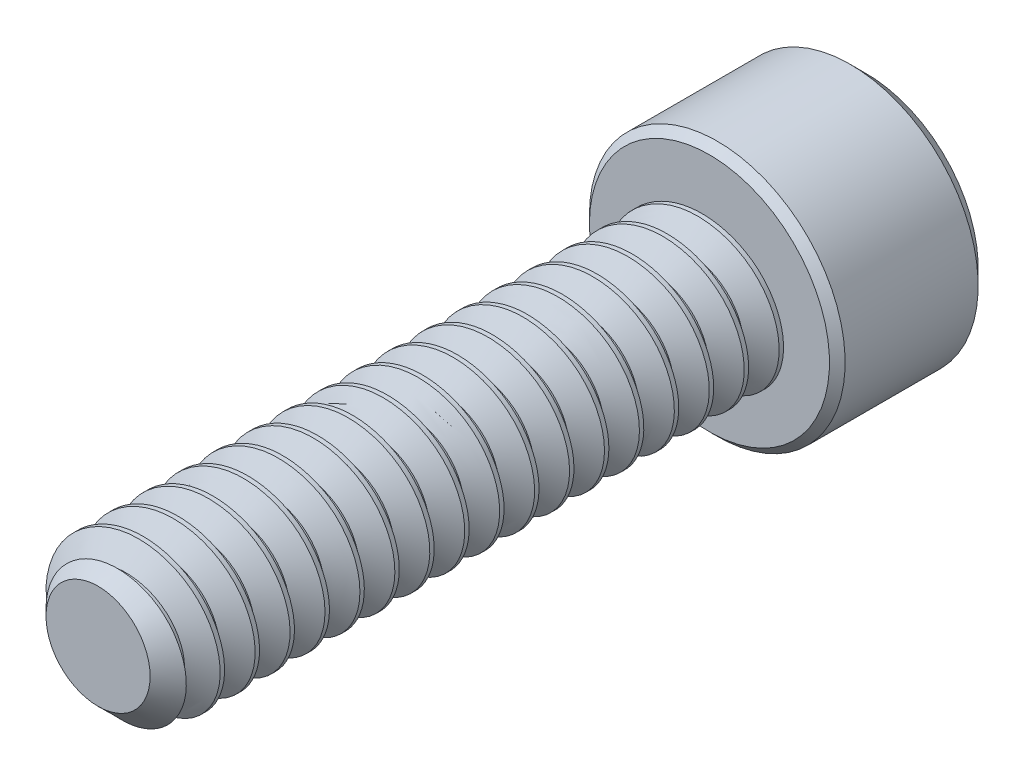
from build123d import *

# Parameters (mm, degrees)
SKETCH1_R          = 1.4224
EXTRUDE1_DEPTH     = 11.1125
CHAMFER3_SIZE      = 0.47625
CUT_SWEEP1_PITCH   = 0.635
SKETCH6_R          = 2.3241
EXTRUDE2_DEPTH     = 2.8448
CUT_EXTRUDE1_DEPTH = 1.7859375
SKETCH8_R          = 1.374815329
CUT_EXTRUDE2_DEPTH = 0.28448
CUT_EXTRUDE2_DRAFT = -45
CHAMFER1_SIZE      = 0.28448
CHAMFER2_SIZE      = 0.14224


with BuildPart() as part:
    # Sketch1 → Extrude1 (new body)
    with BuildSketch(Plane.XY):
        Circle(SKETCH1_R)
    extrude(amount=-EXTRUDE1_DEPTH)

    # Chamfer3
    chamfer3_edges = [part.edges().sort_by_distance(p)[0] for p in [
        (-1.4224, 0, 0),
    ]]
    chamfer(chamfer3_edges, length=CHAMFER3_SIZE)

    # Cut-Sweep1: the profile of Sketch3 profile screwed along a right-hand helix of 18.5 turns, 6 arcs to a turn; built about Z, then put on its axis
    cut_sweep1_z = Axis((0, 0, 0), (0, 0, 1))
    cut_sweep1_corners = [(1.4227, 0, -0.555798205), (1.009955401, 0, -0.3175), (1.009955401, 0, -0.238125), (1.4227, 0, 0.000173205)]
    with BuildLine(mode=Mode.PRIVATE) as cut_sweep1_profile:
        Line(cut_sweep1_corners[0], cut_sweep1_corners[1])
        Line(cut_sweep1_corners[1], cut_sweep1_corners[2])
        Line(cut_sweep1_corners[2], cut_sweep1_corners[3])
        Line(cut_sweep1_corners[3], cut_sweep1_corners[0])
    cut_sweep1_cap = Face(cut_sweep1_profile.wire())
    cut_sweep1_turn_angles = [0, 30, 60, 90, 120, 150, 180, 210, 240, 270, 300, 330, 360]
    cut_sweep1_turn_weights = [1, 0.8660254037844387, 1, 0.8660254037844387, 1, 0.8660254037844387, 1, 0.8660254037844387, 1, 0.8660254037844387, 1, 0.8660254037844387, 1]
    cut_sweep1_turn_rails = [Edge.make_bspline([Vector(p[0], p[1], 0).rotate(cut_sweep1_z, cut_sweep1_turn_angles[k]) / cut_sweep1_turn_weights[k] + Vector(0, 0, p[2] + CUT_SWEEP1_PITCH * cut_sweep1_turn_angles[k] / 360) for k in range(13)], [0, 0, 0, 1, 1, 2, 2, 3, 3, 4, 4, 5, 5, 6, 6, 6], 2, cut_sweep1_turn_weights) for p in cut_sweep1_corners]
    cut_sweep1_turn_sides = [Face.make_surface_from_curves(cut_sweep1_turn_rails[p[0]], cut_sweep1_turn_rails[p[1]]) for p in [(0, 1), (1, 2), (2, 3), (3, 0)]]
    cut_sweep1_last_angles = [6480, 6510, 6540, 6570, 6600, 6630, 6660]
    cut_sweep1_last_weights = [1, 0.8660254037844387, 1, 0.8660254037844387, 1, 0.8660254037843553, 1]
    cut_sweep1_last_rails = [Edge.make_bspline([Vector(p[0], p[1], 0).rotate(cut_sweep1_z, cut_sweep1_last_angles[k]) / cut_sweep1_last_weights[k] + Vector(0, 0, p[2] + CUT_SWEEP1_PITCH * cut_sweep1_last_angles[k] / 360) for k in range(7)], [0, 0, 0, 1, 1, 2, 2, 3, 3, 3], 2, cut_sweep1_last_weights) for p in cut_sweep1_corners]
    cut_sweep1_last_sides = [Face.make_surface_from_curves(cut_sweep1_last_rails[p[0]], cut_sweep1_last_rails[p[1]]) for p in [(0, 1), (1, 2), (2, 3), (3, 0)]]
    cut_sweep1 = Plane(origin=(0, 0, 0), x_dir=(0, 1, 0), z_dir=(0, 0, -1)) * Solid(Shell([*[p.moved(Location((0, 0, CUT_SWEEP1_PITCH * i))) for i in range(18) for p in cut_sweep1_turn_sides], *cut_sweep1_last_sides, cut_sweep1_cap, cut_sweep1_cap.rotate(cut_sweep1_z, 6660).moved(Location((0, 0, CUT_SWEEP1_PITCH * 6660 / 360)))]))
    add(cut_sweep1, mode=Mode.SUBTRACT)

    # Sketch6 → Extrude2 (add)
    with BuildSketch(Plane(origin=(0, 0, -11.1125), x_dir=(-1, 0, 0), z_dir=(0, 0, -1))):
        Circle(SKETCH6_R)
    extrude(amount=EXTRUDE2_DEPTH)

    # Sketch7 → Cut-Extrude1 (cut)
    with BuildSketch(Plane(origin=(0, 0, -13.9573), x_dir=(-1, 0, 0), z_dir=(0, 0, -1))):
        Polygon((0, 1.374815329), (-1.190625, 0.687407664), (-1.190625, -0.687407664), (0, -1.374815329), (1.190625, -0.687407664), (1.190625, 0.687407664), align=None)
    extrude(amount=-CUT_EXTRUDE1_DEPTH, mode=Mode.SUBTRACT)


with BuildPart() as cut_extrude2_tool:
    # Sketch8 → Cut-Extrude2 (with draft: the straight prism first)
    with BuildSketch(Plane(origin=(0, 0, -13.9573), x_dir=(-1, 0, 0), z_dir=(0, 0, -1))):
        Circle(SKETCH8_R)
    extrude(amount=-CUT_EXTRUDE2_DEPTH)
    # Cut-Extrude2: the draft: its side faces are tilted about the plane it starts from
    cut_extrude2_sides = [cut_extrude2_tool.faces().sort_by_distance(p)[0] for p in [
        (1.374815329, 0, -13.81506),
    ]]
    draft(cut_extrude2_sides, Plane(origin=(0, 0, -13.9573), x_dir=(-1, 0, 0), z_dir=(0, 0, -1)), CUT_EXTRUDE2_DRAFT)


with BuildPart() as part_1:
    add(part.part)

    # Cut-Extrude2: cut by cut_extrude2_tool
    add(cut_extrude2_tool.part, mode=Mode.SUBTRACT)

    # Chamfer1
    chamfer1_edges = [part_1.edges().sort_by_distance(p)[0] for p in [
        (2.3241, 0, -13.9573),
    ]]
    chamfer(chamfer1_edges, length=CHAMFER1_SIZE)

    # Chamfer2
    chamfer2_edges = [part_1.edges().sort_by_distance(p)[0] for p in [
        (2.3241, 0, -11.1125),
    ]]
    chamfer(chamfer2_edges, length=CHAMFER2_SIZE)


solid = part_1.part
